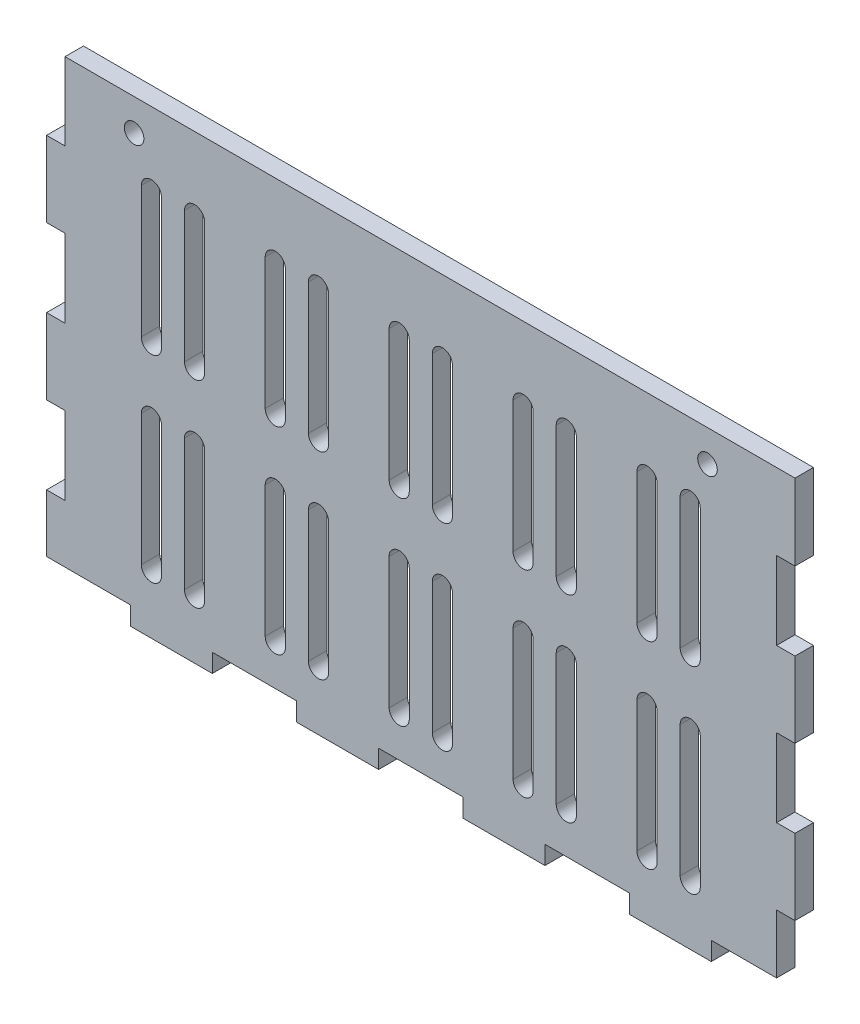
from build123d import *

# Parameters (mm, degrees)
SKETCH1_W             = 130
SKETCH1_H             = 80
BOSS_EXTRUDE1_DEPTH   = 3.2
SKETCH2_W             = 14.444444444
SKETCH2_H             = 3.2
SKETCH2_W_2           = 3.2
SKETCH2_H_2           = 13.333333334
SKETCH2_H_3           = 13.333333333
CUT_EXTRUDE1_DEPTH    = 153.676913775
CUT_EXTRUDE2_REACH    = 154.677
SKETCH3_R             = 1.7
CUT_EXTRUDE3_REACH    = 154.677
WIDTH_TOLERANCE_BY    = 0.1
WIDTH_TOLERANCE_2_BY  = 0.1
WIDTH_TOLERANCE_3_BY  = 0.1
WIDTH_TOLERANCE_4_BY  = 0.1
WIDTH_TOLERANCE_5_BY  = 0.1
WIDTH_TOLERANCE_6_BY  = 0.1
WIDTH_TOLERANCE_7_BY  = 0.1
WIDTH_TOLERANCE_8_BY  = 0.1
WIDTH_TOLERANCE_9_BY  = 0.1
WIDTH_TOLERANCE_10_BY = 0.1
WIDTH_TOLERANCE_11_BY = 0.1
WIDTH_TOLERANCE_12_BY = 0.1
WIDTH_TOLERANCE_13_BY = 0.1
WIDTH_TOLERANCE_14_BY = 0.1
WIDTH_TOLERANCE_15_BY = 0.1
WIDTH_TOLERANCE_16_BY = 0.1
WIDTH_TOLERANCE_17_BY = 0.1
WIDTH_TOLERANCE_18_BY = 0.1


with BuildPart() as part:
    # Sketch1 → Boss-Extrude1 (new body)
    with BuildSketch(Plane.XY):
        with Locations((65, 40)):
            Rectangle(SKETCH1_W, SKETCH1_H)
    extrude(amount=BOSS_EXTRUDE1_DEPTH)

    # Sketch2 → Cut-Extrude1 (cut, through all)
    with BuildSketch(Plane.XY.offset(3.2)):
        with Locations((7.222222222, 1.6)):
            Rectangle(SKETCH2_W, SKETCH2_H)
        with Locations((36.111111111, 1.6)):
            Rectangle(SKETCH2_W, SKETCH2_H)
        with Locations((65, 1.6)):
            Rectangle(SKETCH2_W, SKETCH2_H)
        with Locations((93.888888889, 1.6)):
            Rectangle(SKETCH2_W, SKETCH2_H)
        Polygon((115.555555556, 0), (115.555555556, 3.2), (126.8, 3.2), (126.8, 13.333333333), (130, 13.333333333), (130, 0), align=None)
        with Locations((1.6, 20)):
            Rectangle(SKETCH2_W_2, SKETCH2_H_2)
        with Locations((1.6, 46.666666667)):
            Rectangle(SKETCH2_W_2, SKETCH2_H_3)
        with Locations((1.6, 73.333333334)):
            Rectangle(SKETCH2_W_2, SKETCH2_H_3)
        with Locations((128.4, 33.333333334)):
            Rectangle(SKETCH2_W_2, SKETCH2_H_3)
        with Locations((128.4, 60)):
            Rectangle(SKETCH2_W_2, SKETCH2_H_2)
    extrude(amount=-CUT_EXTRUDE1_DEPTH, mode=Mode.SUBTRACT)

    # Sketch3 → Cut-Extrude2 (cut, up to next)
    with BuildSketch(Plane.XY.offset(3.2), mode=Mode.PRIVATE) as cut_extrude2_sk1:
        with Locations((15.2, 74.5)):
            Circle(SKETCH3_R)
    cut_extrude2_tool1 = extrude(cut_extrude2_sk1.sketch, amount=-CUT_EXTRUDE2_REACH, mode=Mode.PRIVATE) & part.part
    # Sketch3 → Cut-Extrude2 (cut, up to next)
    with BuildSketch(Plane.XY.offset(3.2), mode=Mode.PRIVATE) as cut_extrude2_sk2:
        with Locations((114.8, 74.5)):
            Circle(SKETCH3_R)
    cut_extrude2_tool2 = extrude(cut_extrude2_sk2.sketch, amount=-CUT_EXTRUDE2_REACH, mode=Mode.PRIVATE) & part.part
    add(cut_extrude2_tool1.solids().sort_by_distance((15.2, 74.5, 3.2))[0], mode=Mode.SUBTRACT)
    add(cut_extrude2_tool2.solids().sort_by_distance((114.8, 74.5, 3.2))[0], mode=Mode.SUBTRACT)

    # Sketch4 → Cut-Extrude3 (cut, up to next)
    with BuildSketch(Plane.XY.offset(3.2), mode=Mode.PRIVATE) as cut_extrude3_sk1:
        with BuildLine():
            Line((16.45, 10.2), (16.45, 32.975))
            ThreePointArc((16.45, 32.975), (18.2, 34.725), (19.95, 32.975))
            Line((19.95, 32.975), (19.95, 10.2))
            ThreePointArc((19.95, 10.2), (18.2, 8.45), (16.45, 10.2))
        make_face()
    cut_extrude3_tool1 = extrude(cut_extrude3_sk1.sketch, amount=-CUT_EXTRUDE3_REACH, mode=Mode.PRIVATE) & part.part
    # Sketch4 → Cut-Extrude3 (cut, up to next)
    with BuildSketch(Plane.XY.offset(3.2), mode=Mode.PRIVATE) as cut_extrude3_sk2:
        with BuildLine():
            Line((16.45, 44.475), (16.45, 67.25))
            ThreePointArc((16.45, 67.25), (18.2, 69), (19.95, 67.25))
            Line((19.95, 67.25), (19.95, 44.475))
            ThreePointArc((19.95, 44.475), (18.2, 42.725), (16.45, 44.475))
        make_face()
    cut_extrude3_tool2 = extrude(cut_extrude3_sk2.sketch, amount=-CUT_EXTRUDE3_REACH, mode=Mode.PRIVATE) & part.part
    # Sketch4 → Cut-Extrude3 (cut, up to next)
    with BuildSketch(Plane.XY.offset(3.2), mode=Mode.PRIVATE) as cut_extrude3_sk3:
        with BuildLine():
            Line((23.95, 10.2), (23.95, 32.975))
            ThreePointArc((23.95, 32.975), (25.7, 34.725), (27.45, 32.975))
            Line((27.45, 32.975), (27.45, 10.2))
            ThreePointArc((27.45, 10.2), (25.7, 8.45), (23.95, 10.2))
        make_face()
    cut_extrude3_tool3 = extrude(cut_extrude3_sk3.sketch, amount=-CUT_EXTRUDE3_REACH, mode=Mode.PRIVATE) & part.part
    # Sketch4 → Cut-Extrude3 (cut, up to next)
    with BuildSketch(Plane.XY.offset(3.2), mode=Mode.PRIVATE) as cut_extrude3_sk4:
        with BuildLine():
            Line((23.95, 44.475), (23.95, 67.25))
            ThreePointArc((23.95, 67.25), (25.7, 69), (27.45, 67.25))
            Line((27.45, 67.25), (27.45, 44.475))
            ThreePointArc((27.45, 44.475), (25.7, 42.725), (23.95, 44.475))
        make_face()
    cut_extrude3_tool4 = extrude(cut_extrude3_sk4.sketch, amount=-CUT_EXTRUDE3_REACH, mode=Mode.PRIVATE) & part.part
    # Sketch4 → Cut-Extrude3 (cut, up to next)
    with BuildSketch(Plane.XY.offset(3.2), mode=Mode.PRIVATE) as cut_extrude3_sk5:
        with BuildLine():
            Line((41.475, 10.2), (41.475, 32.975))
            ThreePointArc((41.475, 32.975), (39.725, 34.725), (37.975, 32.975))
            Line((37.975, 32.975), (37.975, 10.2))
            ThreePointArc((37.975, 10.2), (39.725, 8.45), (41.475, 10.2))
        make_face()
    cut_extrude3_tool5 = extrude(cut_extrude3_sk5.sketch, amount=-CUT_EXTRUDE3_REACH, mode=Mode.PRIVATE) & part.part
    # Sketch4 → Cut-Extrude3 (cut, up to next)
    with BuildSketch(Plane.XY.offset(3.2), mode=Mode.PRIVATE) as cut_extrude3_sk6:
        with BuildLine():
            Line((48.975, 10.2), (48.975, 32.975))
            ThreePointArc((48.975, 32.975), (47.225, 34.725), (45.475, 32.975))
            Line((45.475, 32.975), (45.475, 10.2))
            ThreePointArc((45.475, 10.2), (47.225, 8.45), (48.975, 10.2))
        make_face()
    cut_extrude3_tool6 = extrude(cut_extrude3_sk6.sketch, amount=-CUT_EXTRUDE3_REACH, mode=Mode.PRIVATE) & part.part
    # Sketch4 → Cut-Extrude3 (cut, up to next)
    with BuildSketch(Plane.XY.offset(3.2), mode=Mode.PRIVATE) as cut_extrude3_sk7:
        with BuildLine():
            Line((48.975, 44.475), (48.975, 67.25))
            ThreePointArc((48.975, 67.25), (47.225, 69), (45.475, 67.25))
            Line((45.475, 67.25), (45.475, 44.475))
            ThreePointArc((45.475, 44.475), (47.225, 42.725), (48.975, 44.475))
        make_face()
    cut_extrude3_tool7 = extrude(cut_extrude3_sk7.sketch, amount=-CUT_EXTRUDE3_REACH, mode=Mode.PRIVATE) & part.part
    # Sketch4 → Cut-Extrude3 (cut, up to next)
    with BuildSketch(Plane.XY.offset(3.2), mode=Mode.PRIVATE) as cut_extrude3_sk8:
        with BuildLine():
            Line((41.475, 44.475), (41.475, 67.25))
            ThreePointArc((41.475, 67.25), (39.725, 69), (37.975, 67.25))
            Line((37.975, 67.25), (37.975, 44.475))
            ThreePointArc((37.975, 44.475), (39.725, 42.725), (41.475, 44.475))
        make_face()
    cut_extrude3_tool8 = extrude(cut_extrude3_sk8.sketch, amount=-CUT_EXTRUDE3_REACH, mode=Mode.PRIVATE) & part.part
    # Sketch4 → Cut-Extrude3 (cut, up to next)
    with BuildSketch(Plane.XY.offset(3.2), mode=Mode.PRIVATE) as cut_extrude3_sk9:
        with BuildLine():
            Line((63, 10.2), (63, 32.975))
            ThreePointArc((63, 32.975), (61.25, 34.725), (59.5, 32.975))
            Line((59.5, 32.975), (59.5, 10.2))
            ThreePointArc((59.5, 10.2), (61.25, 8.45), (63, 10.2))
        make_face()
    cut_extrude3_tool9 = extrude(cut_extrude3_sk9.sketch, amount=-CUT_EXTRUDE3_REACH, mode=Mode.PRIVATE) & part.part
    # Sketch4 → Cut-Extrude3 (cut, up to next)
    with BuildSketch(Plane.XY.offset(3.2), mode=Mode.PRIVATE) as cut_extrude3_sk10:
        with BuildLine():
            Line((70.5, 10.2), (70.5, 32.975))
            ThreePointArc((70.5, 32.975), (68.75, 34.725), (67, 32.975))
            Line((67, 32.975), (67, 10.2))
            ThreePointArc((67, 10.2), (68.75, 8.45), (70.5, 10.2))
        make_face()
    cut_extrude3_tool10 = extrude(cut_extrude3_sk10.sketch, amount=-CUT_EXTRUDE3_REACH, mode=Mode.PRIVATE) & part.part
    # Sketch4 → Cut-Extrude3 (cut, up to next)
    with BuildSketch(Plane.XY.offset(3.2), mode=Mode.PRIVATE) as cut_extrude3_sk11:
        with BuildLine():
            Line((70.5, 44.475), (70.5, 67.25))
            ThreePointArc((70.5, 67.25), (68.75, 69), (67, 67.25))
            Line((67, 67.25), (67, 44.475))
            ThreePointArc((67, 44.475), (68.75, 42.725), (70.5, 44.475))
        make_face()
    cut_extrude3_tool11 = extrude(cut_extrude3_sk11.sketch, amount=-CUT_EXTRUDE3_REACH, mode=Mode.PRIVATE) & part.part
    # Sketch4 → Cut-Extrude3 (cut, up to next)
    with BuildSketch(Plane.XY.offset(3.2), mode=Mode.PRIVATE) as cut_extrude3_sk12:
        with BuildLine():
            Line((63, 44.475), (63, 67.25))
            ThreePointArc((63, 67.25), (61.25, 69), (59.5, 67.25))
            Line((59.5, 67.25), (59.5, 44.475))
            ThreePointArc((59.5, 44.475), (61.25, 42.725), (63, 44.475))
        make_face()
    cut_extrude3_tool12 = extrude(cut_extrude3_sk12.sketch, amount=-CUT_EXTRUDE3_REACH, mode=Mode.PRIVATE) & part.part
    # Sketch4 → Cut-Extrude3 (cut, up to next)
    with BuildSketch(Plane.XY.offset(3.2), mode=Mode.PRIVATE) as cut_extrude3_sk13:
        with BuildLine():
            Line((84.525, 10.2), (84.525, 32.975))
            ThreePointArc((84.525, 32.975), (82.775, 34.725), (81.025, 32.975))
            Line((81.025, 32.975), (81.025, 10.2))
            ThreePointArc((81.025, 10.2), (82.775, 8.45), (84.525, 10.2))
        make_face()
    cut_extrude3_tool13 = extrude(cut_extrude3_sk13.sketch, amount=-CUT_EXTRUDE3_REACH, mode=Mode.PRIVATE) & part.part
    # Sketch4 → Cut-Extrude3 (cut, up to next)
    with BuildSketch(Plane.XY.offset(3.2), mode=Mode.PRIVATE) as cut_extrude3_sk14:
        with BuildLine():
            Line((92.025, 10.2), (92.025, 32.975))
            ThreePointArc((92.025, 32.975), (90.275, 34.725), (88.525, 32.975))
            Line((88.525, 32.975), (88.525, 10.2))
            ThreePointArc((88.525, 10.2), (90.275, 8.45), (92.025, 10.2))
        make_face()
    cut_extrude3_tool14 = extrude(cut_extrude3_sk14.sketch, amount=-CUT_EXTRUDE3_REACH, mode=Mode.PRIVATE) & part.part
    # Sketch4 → Cut-Extrude3 (cut, up to next)
    with BuildSketch(Plane.XY.offset(3.2), mode=Mode.PRIVATE) as cut_extrude3_sk15:
        with BuildLine():
            Line((92.025, 44.475), (92.025, 67.25))
            ThreePointArc((92.025, 67.25), (90.275, 69), (88.525, 67.25))
            Line((88.525, 67.25), (88.525, 44.475))
            ThreePointArc((88.525, 44.475), (90.275, 42.725), (92.025, 44.475))
        make_face()
    cut_extrude3_tool15 = extrude(cut_extrude3_sk15.sketch, amount=-CUT_EXTRUDE3_REACH, mode=Mode.PRIVATE) & part.part
    # Sketch4 → Cut-Extrude3 (cut, up to next)
    with BuildSketch(Plane.XY.offset(3.2), mode=Mode.PRIVATE) as cut_extrude3_sk16:
        with BuildLine():
            Line((84.525, 44.475), (84.525, 67.25))
            ThreePointArc((84.525, 67.25), (82.775, 69), (81.025, 67.25))
            Line((81.025, 67.25), (81.025, 44.475))
            ThreePointArc((81.025, 44.475), (82.775, 42.725), (84.525, 44.475))
        make_face()
    cut_extrude3_tool16 = extrude(cut_extrude3_sk16.sketch, amount=-CUT_EXTRUDE3_REACH, mode=Mode.PRIVATE) & part.part
    # Sketch4 → Cut-Extrude3 (cut, up to next)
    with BuildSketch(Plane.XY.offset(3.2), mode=Mode.PRIVATE) as cut_extrude3_sk17:
        with BuildLine():
            Line((106.05, 10.2), (106.05, 32.975))
            ThreePointArc((106.05, 32.975), (104.3, 34.725), (102.55, 32.975))
            Line((102.55, 32.975), (102.55, 10.2))
            ThreePointArc((102.55, 10.2), (104.3, 8.45), (106.05, 10.2))
        make_face()
    cut_extrude3_tool17 = extrude(cut_extrude3_sk17.sketch, amount=-CUT_EXTRUDE3_REACH, mode=Mode.PRIVATE) & part.part
    # Sketch4 → Cut-Extrude3 (cut, up to next)
    with BuildSketch(Plane.XY.offset(3.2), mode=Mode.PRIVATE) as cut_extrude3_sk18:
        with BuildLine():
            Line((113.55, 10.2), (113.55, 32.975))
            ThreePointArc((113.55, 32.975), (111.8, 34.725), (110.05, 32.975))
            Line((110.05, 32.975), (110.05, 10.2))
            ThreePointArc((110.05, 10.2), (111.8, 8.45), (113.55, 10.2))
        make_face()
    cut_extrude3_tool18 = extrude(cut_extrude3_sk18.sketch, amount=-CUT_EXTRUDE3_REACH, mode=Mode.PRIVATE) & part.part
    # Sketch4 → Cut-Extrude3 (cut, up to next)
    with BuildSketch(Plane.XY.offset(3.2), mode=Mode.PRIVATE) as cut_extrude3_sk19:
        with BuildLine():
            Line((113.55, 44.475), (113.55, 67.25))
            ThreePointArc((113.55, 67.25), (111.8, 69), (110.05, 67.25))
            Line((110.05, 67.25), (110.05, 44.475))
            ThreePointArc((110.05, 44.475), (111.8, 42.725), (113.55, 44.475))
        make_face()
    cut_extrude3_tool19 = extrude(cut_extrude3_sk19.sketch, amount=-CUT_EXTRUDE3_REACH, mode=Mode.PRIVATE) & part.part
    # Sketch4 → Cut-Extrude3 (cut, up to next)
    with BuildSketch(Plane.XY.offset(3.2), mode=Mode.PRIVATE) as cut_extrude3_sk20:
        with BuildLine():
            Line((106.05, 44.475), (106.05, 67.25))
            ThreePointArc((106.05, 67.25), (104.3, 69), (102.55, 67.25))
            Line((102.55, 67.25), (102.55, 44.475))
            ThreePointArc((102.55, 44.475), (104.3, 42.725), (106.05, 44.475))
        make_face()
    cut_extrude3_tool20 = extrude(cut_extrude3_sk20.sketch, amount=-CUT_EXTRUDE3_REACH, mode=Mode.PRIVATE) & part.part
    add(cut_extrude3_tool1.solids().sort_by_distance((18.2, 21.5875, 3.2))[0], mode=Mode.SUBTRACT)
    add(cut_extrude3_tool2.solids().sort_by_distance((18.2, 55.8625, 3.2))[0], mode=Mode.SUBTRACT)
    add(cut_extrude3_tool3.solids().sort_by_distance((25.7, 21.5875, 3.2))[0], mode=Mode.SUBTRACT)
    add(cut_extrude3_tool4.solids().sort_by_distance((25.7, 55.8625, 3.2))[0], mode=Mode.SUBTRACT)
    add(cut_extrude3_tool5.solids().sort_by_distance((39.725, 21.5875, 3.2))[0], mode=Mode.SUBTRACT)
    add(cut_extrude3_tool6.solids().sort_by_distance((47.225, 21.5875, 3.2))[0], mode=Mode.SUBTRACT)
    add(cut_extrude3_tool7.solids().sort_by_distance((47.225, 55.8625, 3.2))[0], mode=Mode.SUBTRACT)
    add(cut_extrude3_tool8.solids().sort_by_distance((39.725, 55.8625, 3.2))[0], mode=Mode.SUBTRACT)
    add(cut_extrude3_tool9.solids().sort_by_distance((61.25, 21.5875, 3.2))[0], mode=Mode.SUBTRACT)
    add(cut_extrude3_tool10.solids().sort_by_distance((68.75, 21.5875, 3.2))[0], mode=Mode.SUBTRACT)
    add(cut_extrude3_tool11.solids().sort_by_distance((68.75, 55.8625, 3.2))[0], mode=Mode.SUBTRACT)
    add(cut_extrude3_tool12.solids().sort_by_distance((61.25, 55.8625, 3.2))[0], mode=Mode.SUBTRACT)
    add(cut_extrude3_tool13.solids().sort_by_distance((82.775, 21.5875, 3.2))[0], mode=Mode.SUBTRACT)
    add(cut_extrude3_tool14.solids().sort_by_distance((90.275, 21.5875, 3.2))[0], mode=Mode.SUBTRACT)
    add(cut_extrude3_tool15.solids().sort_by_distance((90.275, 55.8625, 3.2))[0], mode=Mode.SUBTRACT)
    add(cut_extrude3_tool16.solids().sort_by_distance((82.775, 55.8625, 3.2))[0], mode=Mode.SUBTRACT)
    add(cut_extrude3_tool17.solids().sort_by_distance((104.3, 21.5875, 3.2))[0], mode=Mode.SUBTRACT)
    add(cut_extrude3_tool18.solids().sort_by_distance((111.8, 21.5875, 3.2))[0], mode=Mode.SUBTRACT)
    add(cut_extrude3_tool19.solids().sort_by_distance((111.8, 55.8625, 3.2))[0], mode=Mode.SUBTRACT)
    add(cut_extrude3_tool20.solids().sort_by_distance((104.3, 55.8625, 3.2))[0], mode=Mode.SUBTRACT)

    # Width tolerance: a face moved inward by 0.1
    extrude(part.faces().sort_by_distance((128.4, 53.333333333, 1.6))[0], amount=WIDTH_TOLERANCE_BY, dir=(0, -1, 0), mode=Mode.SUBTRACT)

    # Width tolerance 2: a face moved inward by 0.1
    extrude(part.faces().sort_by_distance((128.4, 26.666666667, 1.6))[0], amount=WIDTH_TOLERANCE_2_BY, dir=(0, -1, 0), mode=Mode.SUBTRACT)

    # Width tolerance 3: a face moved inward by 0.1
    extrude(part.faces().sort_by_distance((128.4, 13.333333333, 1.6))[0], amount=WIDTH_TOLERANCE_3_BY, dir=(0, 1, 0), mode=Mode.SUBTRACT)

    # Width tolerance 4: a face moved inward by 0.1
    extrude(part.faces().sort_by_distance((128.4, 40, 1.6))[0], amount=WIDTH_TOLERANCE_4_BY, dir=(0, 1, 0), mode=Mode.SUBTRACT)

    # Width tolerance 5: a face moved inward by 0.1
    extrude(part.faces().sort_by_distance((128.4, 66.666666667, 1.6))[0], amount=WIDTH_TOLERANCE_5_BY, dir=(0, 1, 0), mode=Mode.SUBTRACT)

    # Width tolerance 6: a face moved inward by 0.1
    extrude(part.faces().sort_by_distance((115.555555556, 1.6, 1.6))[0], amount=WIDTH_TOLERANCE_6_BY, dir=(-1, 0, 0), mode=Mode.SUBTRACT)

    # Width tolerance 7: a face moved inward by 0.1
    extrude(part.faces().sort_by_distance((86.666666667, 1.6, 1.6))[0], amount=WIDTH_TOLERANCE_7_BY, dir=(-1, 0, 0), mode=Mode.SUBTRACT)

    # Width tolerance 8: a face moved inward by 0.1
    extrude(part.faces().sort_by_distance((57.777777778, 1.6, 1.6))[0], amount=WIDTH_TOLERANCE_8_BY, dir=(-1, 0, 0), mode=Mode.SUBTRACT)

    # Width tolerance 9: a face moved inward by 0.1
    extrude(part.faces().sort_by_distance((28.888888889, 1.6, 1.6))[0], amount=WIDTH_TOLERANCE_9_BY, dir=(-1, 0, 0), mode=Mode.SUBTRACT)

    # Width tolerance 10: a face moved inward by 0.1
    extrude(part.faces().sort_by_distance((14.444444444, 1.6, 1.6))[0], amount=WIDTH_TOLERANCE_10_BY, dir=(1, 0, 0), mode=Mode.SUBTRACT)

    # Width tolerance 11: a face moved inward by 0.1
    extrude(part.faces().sort_by_distance((43.333333333, 1.6, 1.6))[0], amount=WIDTH_TOLERANCE_11_BY, dir=(1, 0, 0), mode=Mode.SUBTRACT)

    # Width tolerance 12: a face moved inward by 0.1
    extrude(part.faces().sort_by_distance((72.222222222, 1.6, 1.6))[0], amount=WIDTH_TOLERANCE_12_BY, dir=(1, 0, 0), mode=Mode.SUBTRACT)

    # Width tolerance 13: a face moved inward by 0.1
    extrude(part.faces().sort_by_distance((101.111111111, 1.6, 1.6))[0], amount=WIDTH_TOLERANCE_13_BY, dir=(1, 0, 0), mode=Mode.SUBTRACT)

    # Width tolerance 14: a face moved inward by 0.1
    extrude(part.faces().sort_by_distance((1.6, 26.666666667, 1.6))[0], amount=WIDTH_TOLERANCE_14_BY, dir=(0, 1, 0), mode=Mode.SUBTRACT)

    # Width tolerance 15: a face moved inward by 0.1
    extrude(part.faces().sort_by_distance((1.6, 13.333333333, 1.6))[0], amount=WIDTH_TOLERANCE_15_BY, dir=(0, -1, 0), mode=Mode.SUBTRACT)

    # Width tolerance 16: a face moved inward by 0.1
    extrude(part.faces().sort_by_distance((1.6, 40, 1.6))[0], amount=WIDTH_TOLERANCE_16_BY, dir=(0, -1, 0), mode=Mode.SUBTRACT)

    # Width tolerance 17: a face moved inward by 0.1
    extrude(part.faces().sort_by_distance((1.6, 53.333333333, 1.6))[0], amount=WIDTH_TOLERANCE_17_BY, dir=(0, 1, 0), mode=Mode.SUBTRACT)

    # Width tolerance 18: a face moved inward by 0.1
    extrude(part.faces().sort_by_distance((1.6, 66.666666667, 1.6))[0], amount=WIDTH_TOLERANCE_18_BY, dir=(0, -1, 0), mode=Mode.SUBTRACT)


solid = part.part
